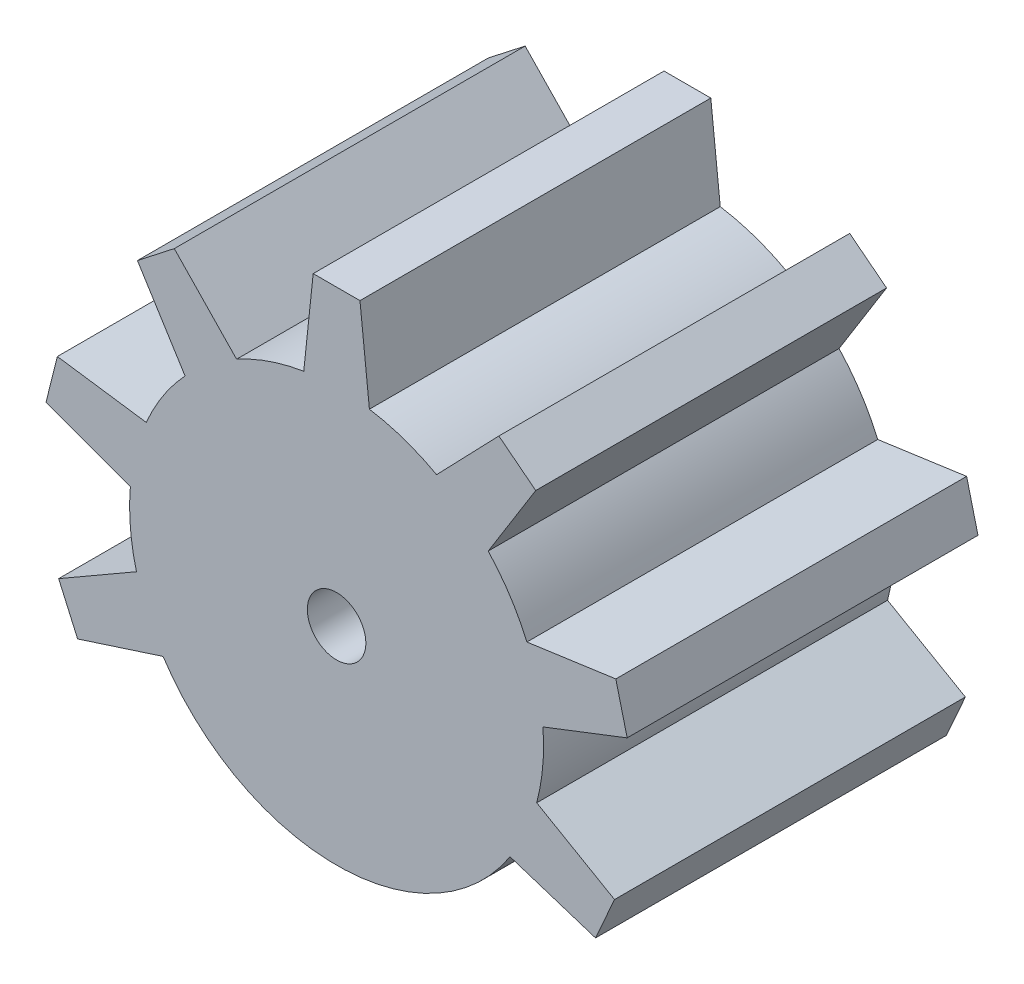
from build123d import *

# Parameters (mm, degrees)
EXTRUDE_2_DEPTH     = 15
SKETCH_5_R          = 1.25
CUT_EXTRUDE_1_DEPTH = 15


with BuildPart() as part:
    # Эскиз3 → Бобышка-Вытянуть2 (new body)
    with BuildSketch(Plane.XY):
        with BuildLine():
            Line((-1, 12.556672608), (0, 12.556672608))
            Line((0, 12.556672608), (1, 12.556672608))
            Line((1, 12.556672608), (1.403768611, 8.737959355))
            ThreePointArc((1.403768611, 8.737959355), (2.882480289, 8.367425374), (4.275666751, 7.748623996))
            Line((4.275666751, 7.748623996), (6.938281237, 10.513338217))
            Line((6.938281237, 10.513338217), (8.514814211, 9.282670194))
            Line((8.514814211, 9.282670194), (6.483307331, 6.024053955))
            ThreePointArc((6.483307331, 6.024053955), (7.419229042, 4.824680344), (8.135910959, 3.482736406))
            Line((8.135910959, 3.482736406), (11.938429132, 4.017951822))
            Line((11.938429132, 4.017951822), (12.423885361, 2.077763107))
            Line((12.423885361, 2.077763107), (8.823580607, 0.683319303))
            ThreePointArc((8.823580607, 0.683319303), (8.813761391, -0.800068834), (8.556312106, -2.260978362))
            Line((8.556312106, -2.260978362), (11.88304599, -4.178904758))
            Line((11.88304599, -4.178904758), (11.071850771, -6.007008197))
            Line((11.071850771, -6.007008197), (7.417581711, -4.827212608))
            ThreePointArc((7.417581711, -4.827212608), (3.5e-08, -8.85), (-7.417581672, -4.827212668))
            Line((-7.417581672, -4.827212668), (-11.071850724, -6.007008285))
            Line((-11.071850724, -6.007008285), (-11.883045968, -4.178904821))
            Line((-11.883045968, -4.178904821), (-8.556312093, -2.260978407))
            ThreePointArc((-8.556312093, -2.260978407), (-8.817386806, -0.759071749), (-8.816843455, 0.765357101))
            Line((-8.816843455, 0.765357101), (-12.423885379, 2.077762999))
            Line((-12.423885379, 2.077762999), (-11.938429167, 4.017951718))
            Line((-11.938429167, 4.017951718), (-8.138356697, 3.477017439))
            ThreePointArc((-8.138356697, 3.477017439), (-7.419229073, 4.824680297), (-6.479071962, 6.028609003))
            Line((-6.479071962, 6.028609003), (-8.514814242, 9.282670165))
            Line((-8.514814242, 9.282670165), (-6.938281272, 10.513338193))
            Line((-6.938281272, 10.513338193), (-4.275666751, 7.748623996))
            ThreePointArc((-4.275666751, 7.748623996), (-2.882480289, 8.367425373), (-1.403768611, 8.737959355))
            Line((-1.403768611, 8.737959355), (-1, 12.556672608))
        make_face()
    extrude(amount=EXTRUDE_2_DEPTH)

    # Эскиз5 → Вырез-Вытянуть1 (cut)
    with BuildSketch(Plane(origin=(0, 0, 0), x_dir=(-1, 0, 0), z_dir=(0, 0, -1))):
        Circle(SKETCH_5_R)
    extrude(amount=-CUT_EXTRUDE_1_DEPTH, mode=Mode.SUBTRACT)


solid = part.part
